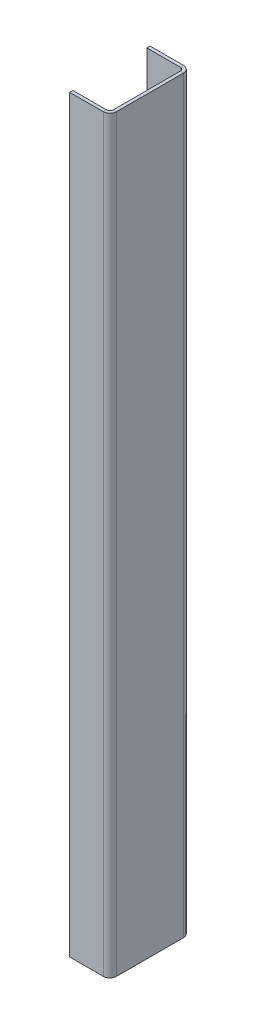
from build123d import *

# Parameters (mm, degrees)
BASE_FLANGE1_DEPTH = 355.6


# Sheet-metal steps are written as plain solids
with BuildPart() as part:
    # Sketch1 → Base-Flange1 (new, symmetric)
    with BuildSketch(Plane(origin=(0, 0, 0), x_dir=(1, 0, 0), z_dir=(0, 1, 0))):
        with BuildLine():
            Line((-38.1, 38.1), (-6.21284, 38.1))
            ThreePointArc((-6.21284, 38.1), (-1.819698706, 36.280301294), (0, 31.88716))
            Line((0, 31.88716), (0, -31.88716))
            ThreePointArc((0, -31.88716), (-1.819698706, -36.280301294), (-6.21284, -38.1))
            Line((-6.21284, -38.1), (-38.1, -38.1))
            Line((-38.1, -38.1), (-38.1, -35.06216))
            Line((-38.1, -35.06216), (-6.21284, -35.06216))
            ThreePointArc((-6.21284, -35.06216), (-3.96777597, -34.13222403), (-3.03784, -31.88716))
            Line((-3.03784, -31.88716), (-3.03784, 31.88716))
            ThreePointArc((-3.03784, 31.88716), (-3.96777597, 34.13222403), (-6.21284, 35.06216))
            Line((-6.21284, 35.06216), (-38.1, 35.06216))
            Line((-38.1, 35.06216), (-38.1, 38.1))
        make_face()
    extrude(amount=BASE_FLANGE1_DEPTH, both=True)


solid = part.part
